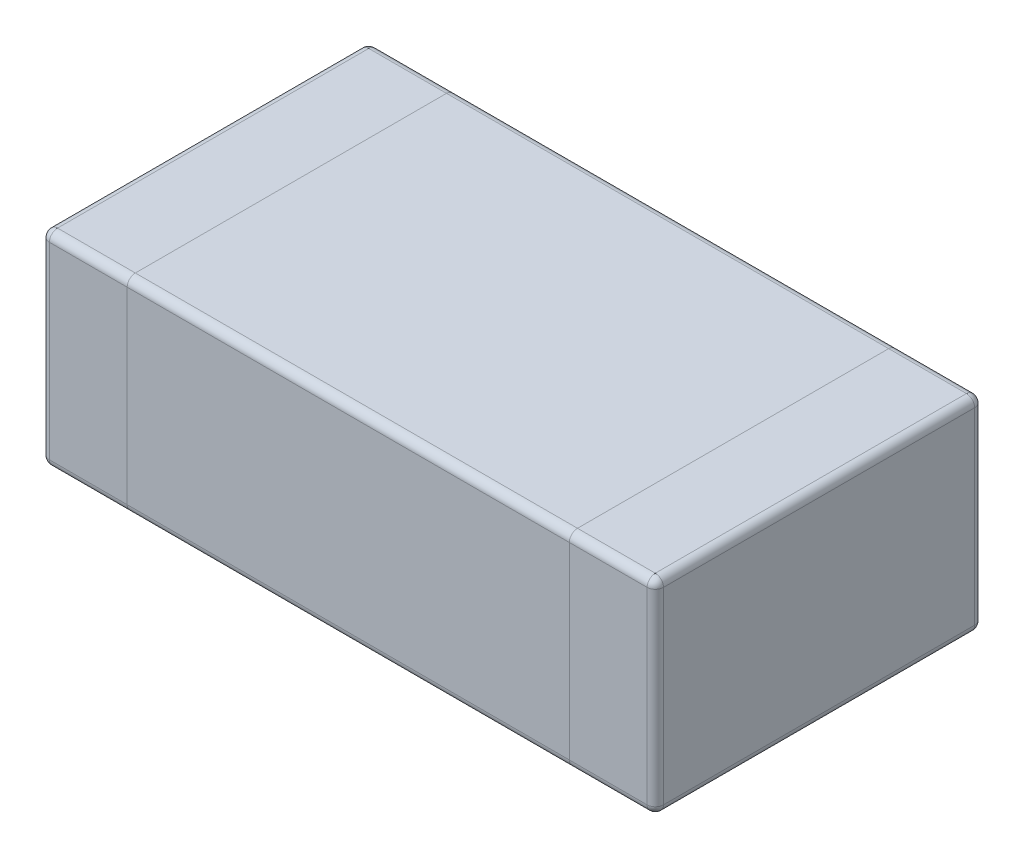
from build123d import *

# Parameters (mm, degrees)
BOSS_EXTRUDE1_DEPTH = 0.25
FILLET2_R           = 0.02


with BuildPart() as part:
    # Sketch1 → Boss-Extrude1 (new, symmetric)
    with BuildSketch(Plane(origin=(0, 0, 0), x_dir=(1, 0, 0), z_dir=(0, 1, 0))):
        with BuildLine():
            Line((-0.73, -0.4), (0.73, -0.4))
            ThreePointArc((0.73, -0.4), (0.744142136, -0.394142136), (0.75, -0.38))
            Line((0.75, -0.38), (0.75, 0.38))
            ThreePointArc((0.75, 0.38), (0.744142136, 0.394142136), (0.73, 0.4))
            Line((0.73, 0.4), (-0.73, 0.4))
            ThreePointArc((-0.73, 0.4), (-0.744142136, 0.394142136), (-0.75, 0.38))
            Line((-0.75, 0.38), (-0.75, -0.38))
            ThreePointArc((-0.75, -0.38), (-0.744142136, -0.394142136), (-0.73, -0.4))
        make_face()
    extrude(amount=BOSS_EXTRUDE1_DEPTH, both=True)

    # Fillet2
    fillet2_edges = [part.edges().sort_by_distance(p)[0] for p in [
        (0, -0.25, 0.4),
        (0, -0.25, 0.4),
        (0, -0.25, 0.4),
        (-0.744142136, -0.25, 0.394142136),
        (-0.75, -0.25, 0),
        (-0.744142136, -0.25, -0.394142136),
        (0, -0.25, -0.4),
        (0, -0.25, -0.4),
        (0, -0.25, -0.4),
        (0.744142136, -0.25, -0.394142136),
        (0.75, -0.25, 0),
        (0.744142136, -0.25, 0.394142136),
        (0, 0.25, -0.4),
        (0, 0.25, -0.4),
        (0, 0.25, -0.4),
        (0.744142136, 0.25, -0.394142136),
        (0.75, 0.25, 0),
        (0.744142136, 0.25, 0.394142136),
        (0, 0.25, 0.4),
        (0, 0.25, 0.4),
        (0, 0.25, 0.4),
        (-0.744142136, 0.25, 0.394142136),
        (-0.75, 0.25, 0),
        (-0.744142136, 0.25, -0.394142136),
    ]]
    fillet(fillet2_edges, radius=FILLET2_R)


solid = part.part
